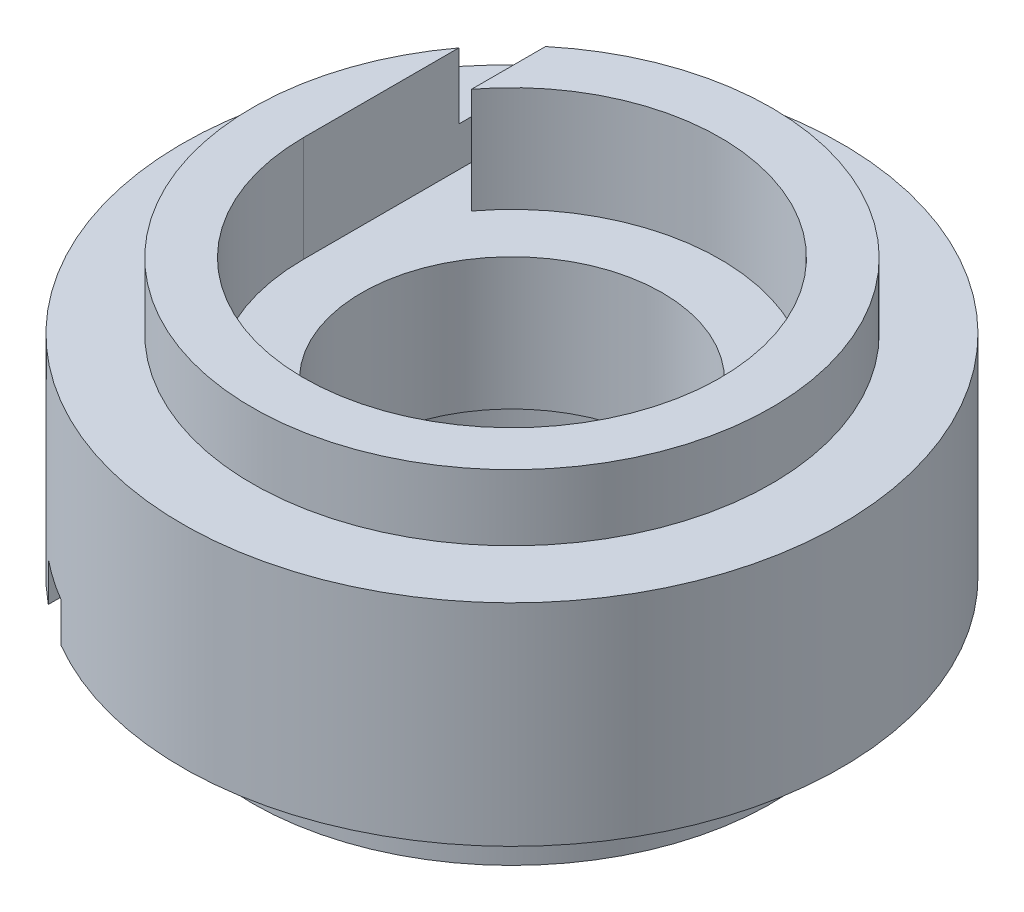
from build123d import *

# Parameters (mm, degrees)
SKETCH1_R           = 31.75
SKETCH1_R_2         = 14.478
BOSS_EXTRUDE1_DEPTH = 16.51
CUT_EXTRUDE1_DEPTH  = 10.16
SKETCH13_R          = 31.75
SKETCH13_R_2        = 25.019
CUT_EXTRUDE2_DEPTH  = 6.35
CIRPATTERN1_COUNT   = 2


with BuildPart() as part:
    # Sketch1 → Boss-Extrude1 (new, symmetric)
    with BuildSketch(Plane(origin=(0, 0, 0), x_dir=(1, 0, 0), z_dir=(0, 1, 0))):
        Circle(SKETCH1_R)
        Circle(SKETCH1_R_2, mode=Mode.SUBTRACT)
    extrude(amount=BOSS_EXTRUDE1_DEPTH, both=True)

    # Sketch2 → Cut-Extrude1 (cut)
    with BuildSketch(Plane(origin=(0, 16.51, 0), x_dir=(1, 0, 0), z_dir=(0, 1, 0))):
        with BuildLine():
            Line((-20.066, 0), (-20.066, 24.60524627))
            ThreePointArc((-20.066, 24.60524627), (-18.088933462, 26.093159759), (-16.002, 27.422590979))
            Line((-16.002, 27.422590979), (-16.002, 12.107037292))
            ThreePointArc((-16.002, 12.107037292), (19.022887373, -6.385460986), (-20.066, 0))
        make_face()
    cut_extrude1 = extrude(amount=-CUT_EXTRUDE1_DEPTH, mode=Mode.SUBTRACT)

    # Sketch13 → Cut-Extrude2 (cut)
    with BuildSketch(Plane(origin=(0, 16.51, 0), x_dir=(1, 0, 0), z_dir=(0, 1, 0))):
        Circle(SKETCH13_R)
        Circle(SKETCH13_R_2, mode=Mode.SUBTRACT)
    cut_extrude2 = extrude(amount=-CUT_EXTRUDE2_DEPTH, mode=Mode.SUBTRACT)

    # CirPattern1: Cut-Extrude1, Cut-Extrude2 ×2 about axis
    cirpattern1_axis = Axis((34.925, 0, 0), (-1, 0, 0))
    add([cut_extrude1.rotate(cirpattern1_axis, i * 360 / CIRPATTERN1_COUNT) for i in range(1, CIRPATTERN1_COUNT)], mode=Mode.SUBTRACT)
    add([cut_extrude2.rotate(cirpattern1_axis, i * 360 / CIRPATTERN1_COUNT) for i in range(1, CIRPATTERN1_COUNT)], mode=Mode.SUBTRACT)


solid = part.part
